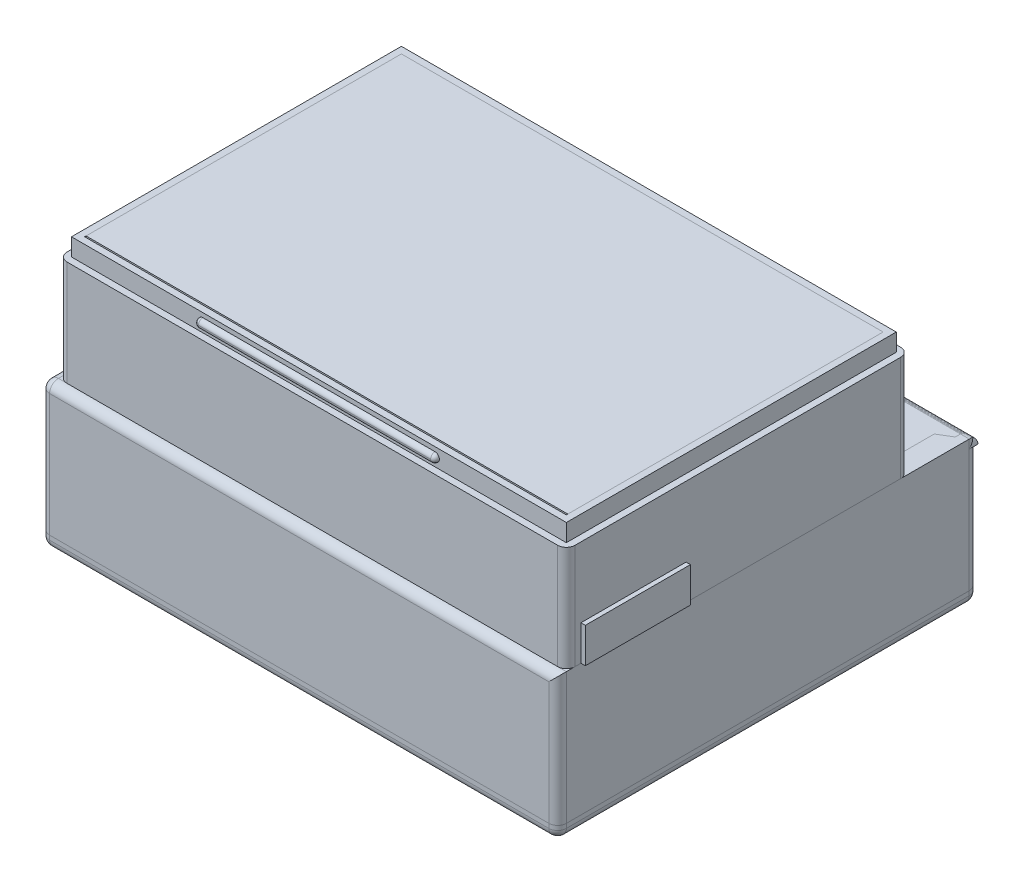
from build123d import *

# Parameters (mm, degrees)
SKETCH2_W                        = 54
SKETCH2_H                        = 43
BOSS_EXTRUDE1_BATTERY_DEPTH      = 14
SKETCH4_W                        = 55
SKETCH4_H                        = 36
BOSS_EXTRUDE2_CIRCUIT_DEPTH      = 14
SKETCH11_W                       = 27
SKETCH11_H                       = 2
CUT_EXTRUDE2_CUTPINS_DEPTH       = 55
SKETCH12_W                       = 12
SKETCH12_H                       = 4
BOSS_EXTRUDE1_BATTERYCON_DEPTH   = 2
SKETCH8_W                        = 8
SKETCH8_H                        = 2
CUT_EXTRUDE3_SWITCHCONNGAP_DEPTH = 10
SKETCH13_W                       = 59
SKETCH13_H                       = 48
SKETCH13_W_2                     = 54
SKETCH13_H_2                     = 43
BOSS_EXTRUDE4_DEPTH              = 15
BOSS_EXTRUDE6_DEPTH              = 3
BOSS_EXTRUDE7_DEPTH              = 1
SKETCH14_6_W                     = 30.255010682
SKETCH14_6_H                     = 1.5
BOSS_EXTRUDE7_2_DEPTH            = 1
BOSS_EXTRUDE9_DEPTH              = 1
SKETCH15_W                       = 58
SKETCH15_H                       = 39.166666667
SKETCH15_W_2                     = 55
SKETCH15_H_2                     = 36.166666667
BOSS_EXTRUDE10_DEPTH             = 14
SKETCH16_W                       = 58
SKETCH16_H                       = 39.166666667
SKETCH16_W_2                     = 56.5
SKETCH16_H_2                     = 37.666666667
CUT_EXTRUDE_LIDCUT_DEPTH         = 2
BOSS_EXTRUDE11_DEPTH             = 0.5
FILLET5_R                        = 0.5
FILLET5_OF_MIRROR1_R             = 0.5
SKETCH18_W                       = 59
SKETCH18_H                       = 48
BOSS_EXTRUDE13_DEPTH             = 1.5
FILLET6_R                        = 1
FILLET7_R                        = 1
FILLET8_R                        = 1
FILLET9_R                        = 1


with BuildPart() as part:
    # Sketch2 → Boss-Extrude1-Battery (new body)
    with BuildSketch(Plane(origin=(0, 0, 0), x_dir=(1, 0, 0), z_dir=(0, 1, 0))):
        Rectangle(SKETCH2_W, SKETCH2_H)
    extrude(amount=BOSS_EXTRUDE1_BATTERY_DEPTH)


with BuildPart() as body_2:
    # Sketch4 → Boss-Extrude2-Circuit (new body)
    with BuildSketch(Plane(origin=(0, 15, 0), x_dir=(1, 0, 0), z_dir=(0, 1, 0))):
        with Locations((0.5, -3.333333333)):
            Rectangle(SKETCH4_W, SKETCH4_H)
    extrude(amount=BOSS_EXTRUDE2_CIRCUIT_DEPTH)

    # Sketch11 → Cut-Extrude2-CutPins (cut)
    with BuildSketch(Plane(origin=(28, 0, 0), x_dir=(0, 0, -1), z_dir=(1, 0, 0))):
        with Locations((1.166666667, 16)):
            Rectangle(SKETCH11_W, SKETCH11_H)
    extrude(amount=-CUT_EXTRUDE2_CUTPINS_DEPTH, mode=Mode.SUBTRACT)

    # Sketch12 → Boss-Extrude1-BatteryCon (add)
    with BuildSketch(Plane(origin=(28, 0, 0), x_dir=(0, 0, -1), z_dir=(1, 0, 0))):
        with Locations((-15.333333333, 17)):
            Rectangle(SKETCH12_W, SKETCH12_H)
    extrude(amount=BOSS_EXTRUDE1_BATTERYCON_DEPTH)

    # Sketch8 → Cut-Extrude3-SwitchConnGap (cut)
    with BuildSketch(Plane.XY.offset(21.333333333)):
        with Locations((-13, 16)):
            Rectangle(SKETCH8_W, SKETCH8_H)
    extrude(amount=-CUT_EXTRUDE3_SWITCHCONNGAP_DEPTH, mode=Mode.SUBTRACT)


with BuildPart() as body_3:
    # Sketch13 → Boss-Extrude4 (new body)
    with BuildSketch(Plane(origin=(0, 0, 0), x_dir=(1, 0, 0), z_dir=(0, 1, 0))):
        Rectangle(SKETCH13_W, SKETCH13_H)
        Rectangle(SKETCH13_W_2, SKETCH13_H_2, mode=Mode.SUBTRACT)
    extrude(amount=BOSS_EXTRUDE4_DEPTH)

    # Fillet6
    fillet6_edges = [body_3.edges().sort_by_distance(p)[0] for p in [
        (0, 15, 24),
        (0, 15, -24),
        (29.5, 7.5, -24),
        (29.5, 7.5, 24),
        (-29.5, 7.5, 24),
        (-29.5, 7.5, -24),
        (-29.5, 15, 0),
    ]]
    fillet(fillet6_edges, radius=FILLET6_R)


with BuildPart() as body_4:
    # Sketch14 → Boss-Extrude6 (new body)
    with BuildSketch(Plane(origin=(0, 14, 0), x_dir=(1, 0, 0), z_dir=(0, 1, 0))):
        Polygon((-25.5, -12.333333333), (-25.5, 13.166666667), (25.5, 13.166666667), (25.5, -9.333333333), (27, -9.333333333), (27, 14.666666667), (-27, 14.666666667), (-27, -12.333333333), align=None)
    extrude(amount=BOSS_EXTRUDE6_DEPTH)


with BuildPart() as body_5:
    # Sketch14<6> → Boss-Extrude7 (new body)
    with BuildSketch(Plane(origin=(0, 14, 0), x_dir=(1, 0, 0), z_dir=(0, 1, 0))):
        Polygon((-25.5, -20), (-25.5, -12.333333333), (-27, -12.333333333), (-27, -21.5), (-17, -21.5), (-17, -20), align=None)
    extrude(amount=BOSS_EXTRUDE7_DEPTH)


with BuildPart() as body_6:
    # Sketch14<6> → Boss-Extrude7 2 (new body)
    with BuildSketch(Plane(origin=(0, 14, 0), x_dir=(1, 0, 0), z_dir=(0, 1, 0))):
        with Locations((6.134582559, -20.75)):
            Rectangle(SKETCH14_6_W, SKETCH14_6_H)
    extrude(amount=BOSS_EXTRUDE7_2_DEPTH)


with BuildPart() as body_7:
    # Sketch14<7> → Boss-Extrude9 (new body)
    with BuildSketch(Plane(origin=(0, 14, 0), x_dir=(1, 0, 0), z_dir=(0, 1, 0))):
        Polygon((-29.5, 14.666666667), (-27, 14.666666667), (27, 14.666666667), (29.5, 14.666666667), (29.5, 24), (-29.5, 24), align=None)
    extrude(amount=BOSS_EXTRUDE9_DEPTH)

    # Fillet7
    fillet7_edges = [body_7.edges().sort_by_distance(p)[0] for p in [
        (29.5, 15, -19.333333333),
        (0, 15, -24),
        (-29.5, 15, -19.333333333),
    ]]
    fillet(fillet7_edges, radius=FILLET7_R - 0.0001)  # a hair under: the kernel refuses the full size


with BuildPart() as body_8:
    # Sketch15 → Boss-Extrude10 (new body)
    with BuildSketch(Plane(origin=(0, 15, 0), x_dir=(1, 0, 0), z_dir=(0, 1, 0))):
        with Locations((0.5, -3.416666666)):
            Rectangle(SKETCH15_W, SKETCH15_H)
        with Locations((0.5, -3.416666666)):
            Rectangle(SKETCH15_W_2, SKETCH15_H_2, mode=Mode.SUBTRACT)
    extrude(amount=BOSS_EXTRUDE10_DEPTH)

    # Sketch16 → Cut-Extrude-LidCut (cut)
    with BuildSketch(Plane(origin=(0, 29, 0), x_dir=(1, 0, 0), z_dir=(0, 1, 0))):
        with Locations((0.5, -3.416666666)):
            Rectangle(SKETCH16_W, SKETCH16_H)
        with Locations((0.5, -3.416666666)):
            Rectangle(SKETCH16_W_2, SKETCH16_H_2, mode=Mode.SUBTRACT)
    extrude(amount=-CUT_EXTRUDE_LIDCUT_DEPTH, mode=Mode.SUBTRACT)

    # Sketch17 → Boss-Extrude11 (add)
    with BuildSketch(Plane.XY.offset(22.25)):
        with BuildLine():
            Line((-12.75, 28.5), (13.75, 28.5))
            ThreePointArc((13.75, 28.5), (14.25, 28), (13.75, 27.5))
            Line((13.75, 27.5), (-12.75, 27.5))
            ThreePointArc((-12.75, 27.5), (-13.25, 28), (-12.75, 28.5))
        make_face()
    boss_extrude11 = extrude(amount=BOSS_EXTRUDE11_DEPTH)

    # Fillet5
    fillet5_edges = [body_8.edges().sort_by_distance(p)[0] for p in [
        (14.25, 28, 22.75),
        (-13.25, 28, 22.75),
        (0.5, 27.5, 22.75),
        (0.5, 28.5, 22.75),
    ]]
    fillet(fillet5_edges, radius=FILLET5_R - 0.0001)  # a hair under: the kernel refuses the full size

    # Mirror1: Boss-Extrude11 across plane
    add(boss_extrude11.mirror(Plane(origin=(0, 0, 3.416666667), x_dir=(1, 0, 0), z_dir=(0, 0, -1))))

    # Fillet5 of Mirror1
    fillet5_of_mirror1_edges = [body_8.edges().sort_by_distance(p)[0] for p in [
        (14.25, 28, -15.916666667),
        (-13.25, 28, -15.916666667),
        (0.5, 27.5, -15.916666667),
        (0.5, 28.5, -15.916666667),
    ]]
    fillet(fillet5_of_mirror1_edges, radius=FILLET5_OF_MIRROR1_R - 0.0001)  # a hair under: the kernel refuses the full size

    # Fillet8
    fillet8_edges = [body_8.edges().sort_by_distance(p)[0] for p in [
        (29.5, 21, -16.166666667),
        (29.5, 21, 23),
        (-28.5, 21, 23),
        (-28.5, 21, -16.166666667),
    ]]
    fillet(fillet8_edges, radius=FILLET8_R)


with BuildPart() as body_9:
    # Sketch18 → Boss-Extrude13 (new body)
    with BuildSketch(Plane.XZ):
        Rectangle(SKETCH18_W, SKETCH18_H)
    extrude(amount=BOSS_EXTRUDE13_DEPTH)

    # Fillet9
    fillet9_edges = [body_9.edges().sort_by_distance(p)[0] for p in [
        (29.5, -1.5, 0),
        (0, -1.5, 24),
        (-29.5, -1.5, 0),
        (-29.5, -0.75, 24),
        (29.5, -0.75, 24),
        (29.5, -0.75, -24),
        (-29.5, -0.75, -24),
        (0, -1.5, -24),
    ]]
    fillet(fillet9_edges, radius=FILLET9_R)


solid = Compound([part.part, body_2.part, body_3.part, body_4.part, body_5.part, body_6.part, body_7.part, body_8.part, body_9.part])
